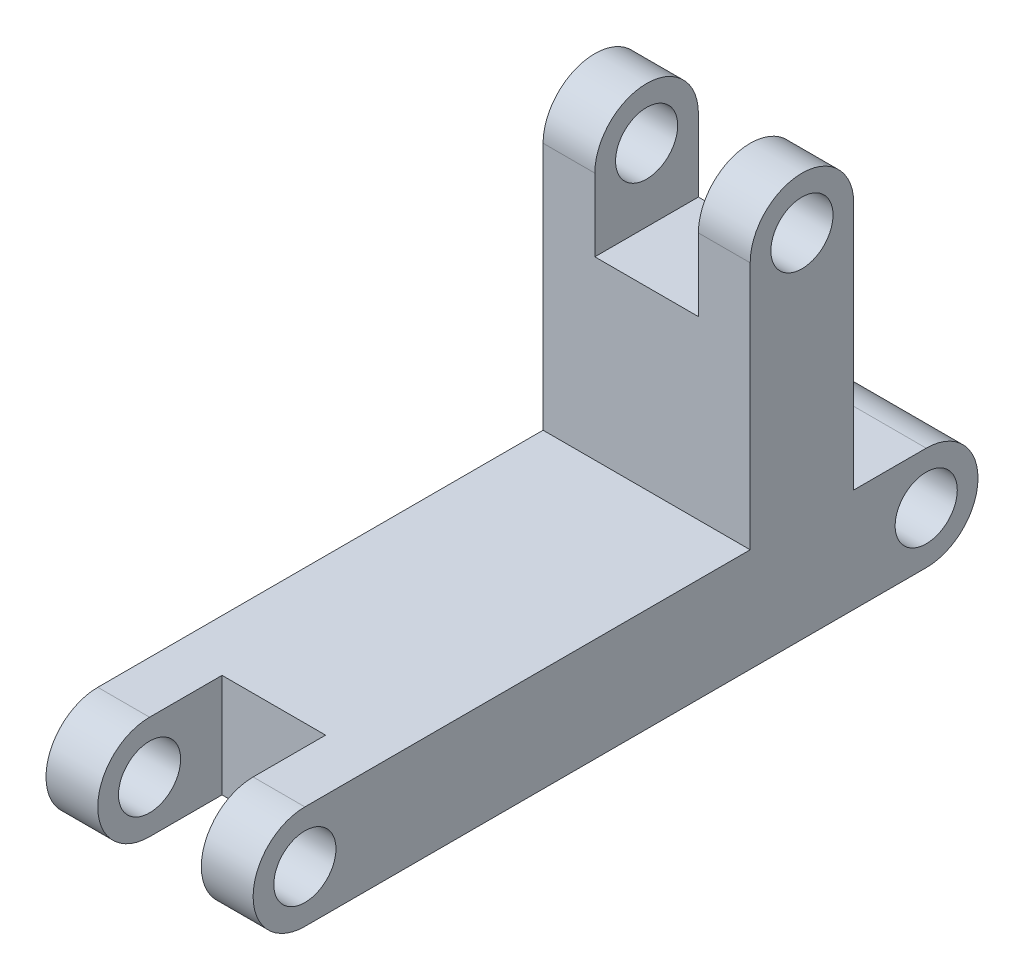
from build123d import *

# Parameters (mm, degrees)
CROQUIS1_R              = 1.5
SALIENTE_EXTRUIR1_DEPTH = 5
CROQUIS2_W              = 5
CROQUIS2_H              = 6
CROQUIS2_W_2            = 6
CROQUIS2_H_2            = 5
CORTAR_EXTRUIR1_DEPTH   = 2.5


with BuildPart() as part:
    # Croquis1 → Saliente-Extruir1 (new, symmetric)
    with BuildSketch(Plane(origin=(0, 0, 0), x_dir=(0, 0, -1), z_dir=(1, 0, 0))):
        with BuildLine():
            Line((-15, 2.5), (6.5, 2.5))
            Line((6.5, 2.5), (6.5, 14.5))
            ThreePointArc((6.5, 14.5), (9, 17), (11.5, 14.5))
            Line((11.5, 14.5), (11.5, 2.5))
            Line((11.5, 2.5), (15, 2.5))
            ThreePointArc((15, 2.5), (17.5, 0), (15, -2.5))
            Line((15, -2.5), (-15, -2.5))
            ThreePointArc((-15, -2.5), (-17.5, 0), (-15, 2.5))
        make_face()
        with Locations((15, 0)):
            Circle(CROQUIS1_R, mode=Mode.SUBTRACT)
        with Locations((9, 14.5)):
            Circle(CROQUIS1_R, mode=Mode.SUBTRACT)
        with Locations((-15, 0)):
            Circle(CROQUIS1_R, mode=Mode.SUBTRACT)
    extrude(amount=SALIENTE_EXTRUIR1_DEPTH, both=True)

    # Croquis2 → Cortar-Extruir1 (cut, symmetric)
    with BuildSketch(Plane(origin=(0, 0, 0), x_dir=(0, 0, -1), z_dir=(1, 0, 0))):
        with Locations((9, 14)):
            Rectangle(CROQUIS2_W, CROQUIS2_H)
        with Locations((-14.5, 0)):
            Rectangle(CROQUIS2_W_2, CROQUIS2_H_2)
    extrude(amount=CORTAR_EXTRUIR1_DEPTH, both=True, mode=Mode.SUBTRACT)


solid = part.part
